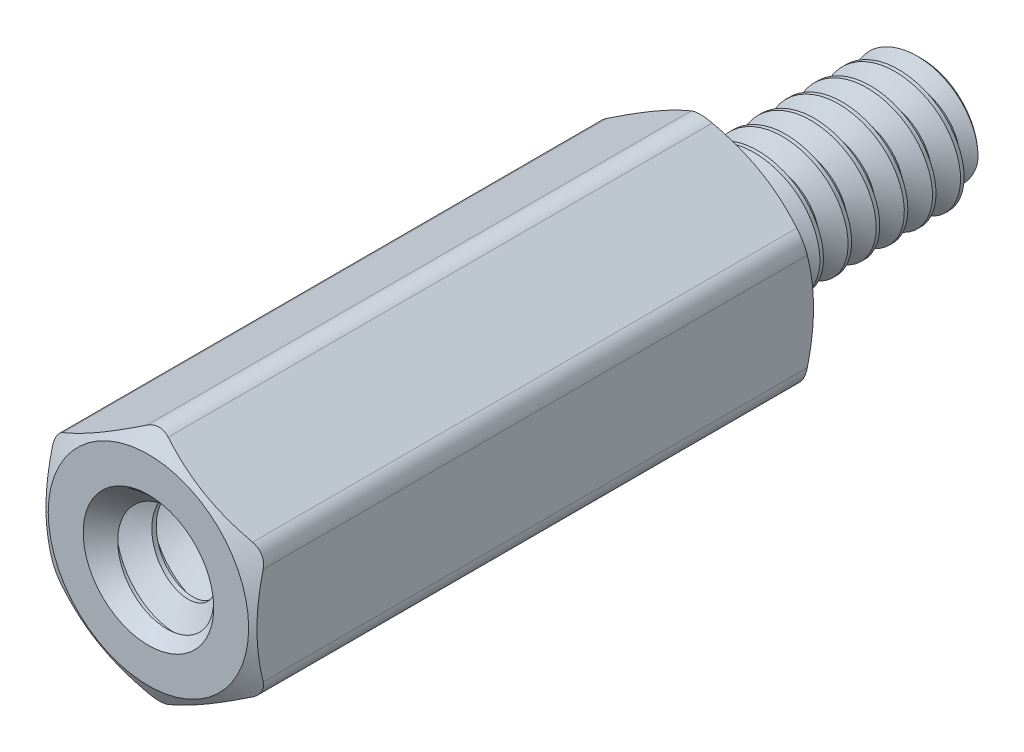
from build123d import *

# Parameters (mm, degrees)
SKETCH4_R           = 1.901825
BOSS_EXTRUDE1_DEPTH = 12.7
SKETCH5_OUTSIDE_W   = 75.8
SKETCH5_OUTSIDE_H   = 76.538
SKETCH5_OUTSIDE_R   = 2.2621875
CUT_EXTRUDE1_DEPTH  = 18.837312762
CUT_EXTRUDE1_DRAFT  = -60
SKETCH6_OUTSIDE_W   = 59.772
SKETCH6_OUTSIDE_H   = 60.51
SKETCH6_OUTSIDE_R   = 2.2621875
CUT_EXTRUDE2_DEPTH  = 14.210632851
CUT_EXTRUDE2_DRAFT  = -60
FILLET1_R           = 0.47625
CUT_SWEEP1_PITCH    = 0.635
SKETCH9_R           = 1.58115
BOSS_EXTRUDE2_DEPTH = 6.35
SKETCH10_W          = 6.35
SKETCH10_H          = 1.4224
CUT_SWEEP2_PITCH    = 0.79375


with BuildPart() as part:
    # Sketch3 → Revolve1 (revolve)
    with BuildSketch(Plane(origin=(0, 0, 0), x_dir=(0, 0, -1), z_dir=(1, 0, 0))):
        with BuildLine():
            Line((-6.35, 1.26365), (-6.35, 0))
            Line((-6.35, 0), (4.7625, 0))
            Line((4.7625, 0), (4.7625, 1.26365))
            Line((4.7625, 1.26365), (4.60375, 1.4224))
            Line((4.60375, 1.4224), (0.809625, 1.4224))
            Line((0.809625, 1.4224), (0.5715, 1.009955401))
            Line((0.5715, 1.009955401), (0.15875, 1.009955401))
            ThreePointArc((0.15875, 1.009955401), (0.046496798, 1.0564522), (0, 1.168705401))
            Line((0, 1.168705401), (0, 2.38125))
            Line((0, 2.38125), (-12.7, 2.38125))
            Line((-12.7, 2.38125), (-12.7, 1.58115))
            Line((-12.7, 1.58115), (-12.54125, 1.4224))
            Line((-12.54125, 1.4224), (-6.50875, 1.4224))
            Line((-6.50875, 1.4224), (-6.35, 1.26365))
        make_face()
    revolve(axis=Axis((0, 0, -4.7625), (0, 0, 1)))

    # Sketch4 → Boss-Extrude1 (add)
    with BuildSketch(Plane.XY.offset(12.7)):
        Polygon((-2.38125, 1.374815329), (-2.38125, -1.374815329), (0, -2.749630657), (2.38125, -1.374815329), (2.38125, 1.374815329), (0, 2.749630657), align=None)
        Circle(SKETCH4_R, mode=Mode.SUBTRACT)
    extrude(amount=-BOSS_EXTRUDE1_DEPTH)


with BuildPart() as cut_extrude1_tool:
    # Sketch5 outside → Cut-Extrude1 (with draft: the straight prism first)
    with BuildSketch(Plane.XY.offset(12.7)):
        Rectangle(SKETCH5_OUTSIDE_W, SKETCH5_OUTSIDE_H)
        Circle(SKETCH5_OUTSIDE_R, mode=Mode.SUBTRACT)
    extrude(amount=-CUT_EXTRUDE1_DEPTH)
    # Cut-Extrude1: the draft: its side faces are tilted about the plane it starts from
    cut_extrude1_sides = [cut_extrude1_tool.faces().sort_by_distance(p)[0] for p in [
        (0, -38.269, 3.281343619),
        (37.9, 0, 3.281343619),
        (0, 38.269, 3.281343619),
        (-37.9, 0, 3.281343619),
        (-2.2621875, 0, 3.281343619),
    ]]
    draft(cut_extrude1_sides, Plane.XY.offset(12.7), CUT_EXTRUDE1_DRAFT)


with BuildPart() as part_1:
    add(part.part)

    # Cut-Extrude1: cut by cut_extrude1_tool
    add(cut_extrude1_tool.part, mode=Mode.SUBTRACT)


with BuildPart() as cut_extrude2_tool:
    # Sketch6 outside → Cut-Extrude2 (with draft: the straight prism first)
    with BuildSketch(Plane(origin=(0, 0, 0), x_dir=(-1, 0, 0), z_dir=(0, 0, -1))):
        Rectangle(SKETCH6_OUTSIDE_W, SKETCH6_OUTSIDE_H)
        Circle(SKETCH6_OUTSIDE_R, mode=Mode.SUBTRACT)
    extrude(amount=-CUT_EXTRUDE2_DEPTH)
    # Cut-Extrude2: the draft: its side faces are tilted about the plane it starts from
    cut_extrude2_sides = [cut_extrude2_tool.faces().sort_by_distance(p)[0] for p in [
        (0, -30.255, 7.105316425),
        (-29.886, 0, 7.105316425),
        (0, 30.255, 7.105316425),
        (29.886, 0, 7.105316425),
        (2.2621875, 0, 7.105316425),
    ]]
    draft(cut_extrude2_sides, Plane(origin=(0, 0, 0), x_dir=(-1, 0, 0), z_dir=(0, 0, -1)), CUT_EXTRUDE2_DRAFT)


with BuildPart() as part_2:
    add(part_1.part)

    # Cut-Extrude2: cut by cut_extrude2_tool
    add(cut_extrude2_tool.part, mode=Mode.SUBTRACT)

    # Fillet1
    fillet1_edges = [part_2.edges().sort_by_distance(p)[0] for p in [
        (0, 2.749630657, 6.35),
        (-2.38125, -1.374815329, 6.35),
        (0, -2.749630657, 6.35),
        (2.38125, -1.374815329, 6.35),
        (2.38125, 1.374815329, 6.35),
        (-2.38125, 1.374815329, 6.35),
    ]]
    fillet(fillet1_edges, radius=FILLET1_R)

    # Cut-Sweep1: the profile of Sketch7 profile screwed along a right-hand helix of 7.275 turns, 6 arcs to a turn; built about Z, then put on its axis
    cut_sweep1_z = Axis((0, 0, 0), (0, 0, 1))
    cut_sweep1_corners = [(1.009655401, 0, -0.238298205), (1.009655401, 0, -0.317326795), (1.456770383, 0, -0.57546875), (1.456770383, 0, 0.01984375)]
    with BuildLine(mode=Mode.PRIVATE) as cut_sweep1_profile:
        Line(cut_sweep1_corners[0], cut_sweep1_corners[1])
        Line(cut_sweep1_corners[1], cut_sweep1_corners[2])
        Line(cut_sweep1_corners[2], cut_sweep1_corners[3])
        Line(cut_sweep1_corners[3], cut_sweep1_corners[0])
    cut_sweep1_cap = Face(cut_sweep1_profile.wire())
    cut_sweep1_turn_angles = [0, 30, 60, 90, 120, 150, 180, 210, 240, 270, 300, 330, 360]
    cut_sweep1_turn_weights = [1, 0.8660254037844387, 1, 0.8660254037844387, 1, 0.8660254037844387, 1, 0.8660254037844387, 1, 0.8660254037844387, 1, 0.8660254037844387, 1]
    cut_sweep1_turn_rails = [Edge.make_bspline([Vector(p[0], p[1], 0).rotate(cut_sweep1_z, cut_sweep1_turn_angles[k]) / cut_sweep1_turn_weights[k] + Vector(0, 0, p[2] + CUT_SWEEP1_PITCH * cut_sweep1_turn_angles[k] / 360) for k in range(13)], [0, 0, 0, 1, 1, 2, 2, 3, 3, 4, 4, 5, 5, 6, 6, 6], 2, cut_sweep1_turn_weights) for p in cut_sweep1_corners]
    cut_sweep1_turn_sides = [Face.make_surface_from_curves(cut_sweep1_turn_rails[p[0]], cut_sweep1_turn_rails[p[1]]) for p in [(0, 1), (1, 2), (2, 3), (3, 0)]]
    cut_sweep1_last_angles = [2520, 2550, 2580, 2599.5, 2619]
    cut_sweep1_last_weights = [1, 0.8660254037844387, 1, 0.9426414910921823, 1]
    cut_sweep1_last_rails = [Edge.make_bspline([Vector(p[0], p[1], 0).rotate(cut_sweep1_z, cut_sweep1_last_angles[k]) / cut_sweep1_last_weights[k] + Vector(0, 0, p[2] + CUT_SWEEP1_PITCH * cut_sweep1_last_angles[k] / 360) for k in range(5)], [0, 0, 0, 1, 1, 2, 2, 2], 2, cut_sweep1_last_weights) for p in cut_sweep1_corners]
    cut_sweep1_last_sides = [Face.make_surface_from_curves(cut_sweep1_last_rails[p[0]], cut_sweep1_last_rails[p[1]]) for p in [(0, 1), (1, 2), (2, 3), (3, 0)]]
    cut_sweep1 = Plane(origin=(0, 0, -4.7625), x_dir=(0, 1, 0), z_dir=(0, 0, 1)) * Solid(Shell([*[p.moved(Location((0, 0, CUT_SWEEP1_PITCH * i))) for i in range(7) for p in cut_sweep1_turn_sides], *cut_sweep1_last_sides, cut_sweep1_cap, cut_sweep1_cap.rotate(cut_sweep1_z, 2619).moved(Location((0, 0, CUT_SWEEP1_PITCH * 2619 / 360)))]))
    add(cut_sweep1, mode=Mode.SUBTRACT)

    # Sketch9 → Boss-Extrude2 (add)
    with BuildSketch(Plane.XY.offset(6.35)):
        Circle(SKETCH9_R)
    extrude(amount=BOSS_EXTRUDE2_DEPTH)


with BuildPart() as body_2:
    # Sketch10 → Revolve2 (revolve)
    with BuildSketch(Plane(origin=(0, 0, 0), x_dir=(0, 0, -1), z_dir=(1, 0, 0))):
        with Locations((-9.525, 0.7112)):
            Rectangle(SKETCH10_W, SKETCH10_H)
    revolve(axis=Axis((0, 0, -4.7625), (0, 0, 1)))

    # Cut-Sweep2: the profile of Sketch12 screwed along a right-hand helix of 9 turns, 8 arcs to a turn; built about Z, then put on its axis
    cut_sweep2_z = Axis((0, 0, 0), (0, 0, 1))
    cut_sweep2_corners = [(0.906844252, 0, -0.396875), (0.906844252, 0, -0.29765625), (1.465362979, 0, 0.024804687), (1.465362979, 0, -0.719335937)]
    with BuildLine(mode=Mode.PRIVATE) as cut_sweep2_profile:
        Line(cut_sweep2_corners[0], cut_sweep2_corners[1])
        Line(cut_sweep2_corners[1], cut_sweep2_corners[2])
        Line(cut_sweep2_corners[2], cut_sweep2_corners[3])
        Line(cut_sweep2_corners[3], cut_sweep2_corners[0])
    cut_sweep2_cap = Face(cut_sweep2_profile.wire())
    cut_sweep2_turn_angles = [0, 22.5, 45, 67.5, 90, 112.5, 135, 157.5, 180, 202.5, 225, 247.5, 270, 292.5, 315, 337.5, 360]
    cut_sweep2_turn_weights = [1, 0.9238795325112867, 1, 0.9238795325112867, 1, 0.9238795325112867, 1, 0.9238795325112867, 1, 0.9238795325112867, 1, 0.9238795325112867, 1, 0.9238795325112867, 1, 0.9238795325112867, 1]
    cut_sweep2_turn_rails = [Edge.make_bspline([Vector(p[0], p[1], 0).rotate(cut_sweep2_z, cut_sweep2_turn_angles[k]) / cut_sweep2_turn_weights[k] + Vector(0, 0, p[2] + CUT_SWEEP2_PITCH * cut_sweep2_turn_angles[k] / 360) for k in range(17)], [0, 0, 0, 1, 1, 2, 2, 3, 3, 4, 4, 5, 5, 6, 6, 7, 7, 8, 8, 8], 2, cut_sweep2_turn_weights) for p in cut_sweep2_corners]
    cut_sweep2_turn_sides = [Face.make_surface_from_curves(cut_sweep2_turn_rails[p[0]], cut_sweep2_turn_rails[p[1]]) for p in [(0, 1), (1, 2), (2, 3), (3, 0)]]
    cut_sweep2 = Plane(origin=(0, 0, 12.7), x_dir=(0, 1, 0), z_dir=(0, 0, -1)) * Solid(Shell([*[p.moved(Location((0, 0, CUT_SWEEP2_PITCH * i))) for i in range(9) for p in cut_sweep2_turn_sides], cut_sweep2_cap, cut_sweep2_cap.rotate(cut_sweep2_z, 3240).moved(Location((0, 0, CUT_SWEEP2_PITCH * 3240 / 360)))]))
    add(cut_sweep2, mode=Mode.SUBTRACT)


with BuildPart() as part_3:
    add(part_2.part)

    # Combine1: cut body 2
    add(body_2.part, mode=Mode.SUBTRACT)

    # Cut-Extrude3 cone 1 section (through the dimple's axis) → Cut-Extrude3 (revolve, cut)
    with BuildSketch(Plane(origin=(0, 0, 12.7), x_dir=(0, -1, 0), z_dir=(1, 0, 0))):
        Polygon((0, 0), (1.4732, 0), (0, 1.4732), align=None)
    revolve(axis=Axis((0, 0, 12.7), (0, 0, -1)), mode=Mode.SUBTRACT)


solid = part_3.part
